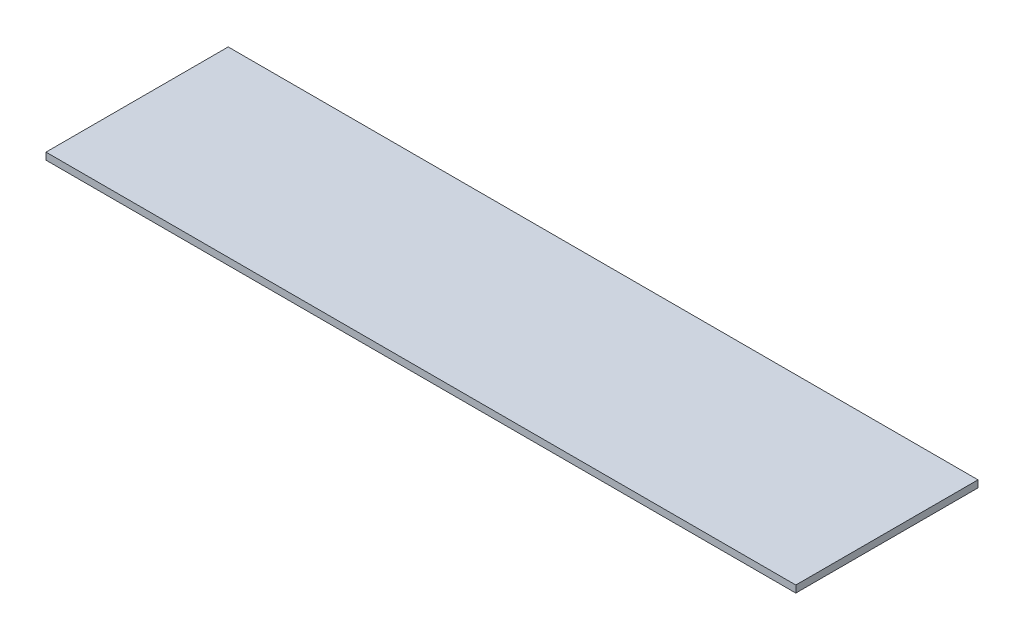
from build123d import *

# Parameters (mm, degrees)
SKETCH1_W           = 2140
SKETCH1_H           = 520
BOSS_EXTRUDE1_DEPTH = 20


with BuildPart() as part:
    # Sketch1 → Boss-Extrude1 (new body)
    with BuildSketch(Plane(origin=(0, 0, 0), x_dir=(1, 0, 0), z_dir=(0, 1, 0))):
        with Locations((1070, 260)):
            Rectangle(SKETCH1_W, SKETCH1_H)
    extrude(amount=BOSS_EXTRUDE1_DEPTH)


solid = part.part
